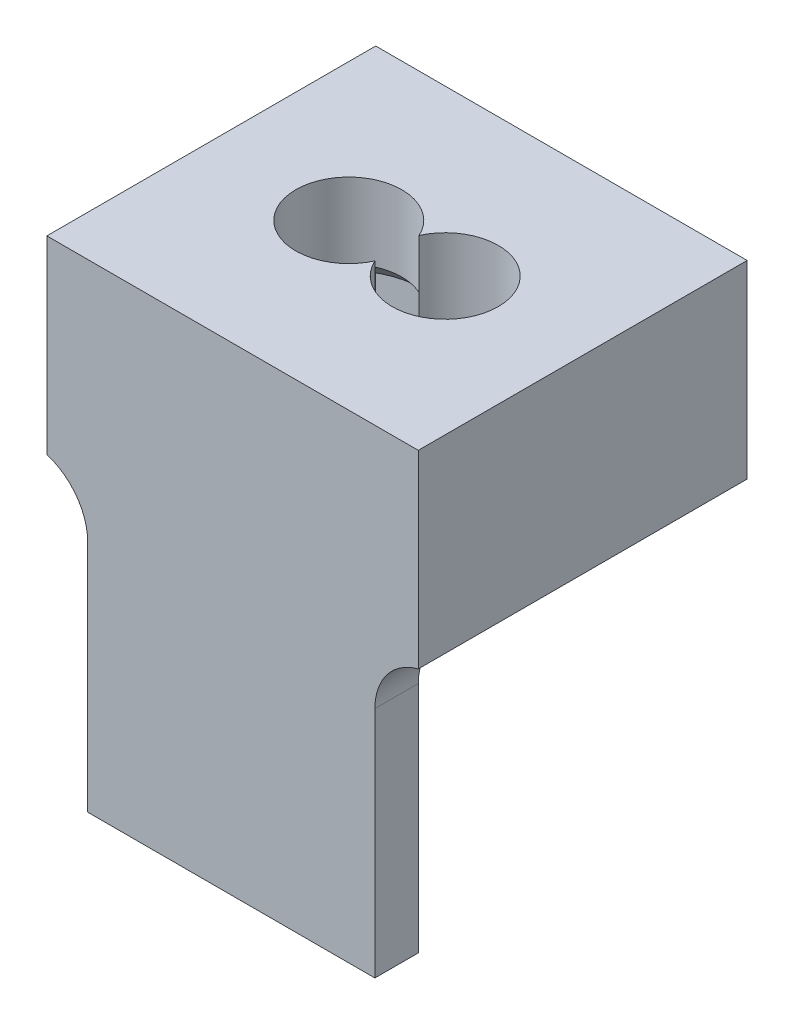
from build123d import *

# Parameters (mm, degrees)
BOSS_EXTRUDE1_DEPTH      = 0.7
BOSS_EXTRUDE1_DEPTH_BACK = 1.263
SKETCH1_W                = 3.850998
SKETCH1_H                = 3.4098
CAVITY1_START            = 0.637466597
CAVITY1_OUTLINE_W        = 2.67750798
CAVITY1_OUTLINE_H        = 0.979282
CAVITY1_DEPTH            = 2.231898
CAVITY1_2_DEPTH          = 0.410464
CAVITY1_START_2          = 2.458900597
CAVITY1_3_DEPTH          = 0.410464
CAVITY1_START_3          = -17.14430724
CAVITY1_4_DEPTH          = 2.648519043
CHAMFER1_SIZE            = 0.2
CHAMFER2_SIZE            = 0.15
SKETCH2_W                = 2.97750798
SKETCH2_H                = 0.45
BOSS_EXTRUDE2_DEPTH      = 3
FILLET1_R                = 0.6


with BuildPart() as part:
    # Sketch1 → Boss-Extrude1 (new, two sides: drawn at the far end of the back side and taken through both)
    with BuildSketch(Plane(origin=(0, 13.835346538, 0), x_dir=(1, 0, 0), z_dir=(0, 1, 0)).offset(-BOSS_EXTRUDE1_DEPTH_BACK)):
        with Locations((-15.821287197, -1.764464597)):
            Rectangle(SKETCH1_W, SKETCH1_H)
        with BuildLine():
            ThreePointArc((-15.821287197, -1.53533363), (-16.871286197, -1.764464597), (-15.821287197, -1.993595564))
            ThreePointArc((-15.821287197, -1.993595564), (-14.771288197, -1.764464597), (-15.821287197, -1.53533363))
        make_face(mode=Mode.SUBTRACT)
    extrude(amount=BOSS_EXTRUDE1_DEPTH + BOSS_EXTRUDE1_DEPTH_BACK)

    # Cavity1: read off the stored shape, not the designer's step
    # Cavity1 outline → Cavity1 (cut)
    with BuildSketch(Plane.XY.offset(CAVITY1_START)):
        with Locations((-15.834542187, 13.061987538)):
            Rectangle(CAVITY1_OUTLINE_W, CAVITY1_OUTLINE_H)
    extrude(amount=CAVITY1_DEPTH, mode=Mode.SUBTRACT)

    # Cavity1 2 outline → Cavity1 2 (cut)
    with BuildSketch(Plane.XY.offset(CAVITY1_START)):
        Polygon((-16.966571114, 13.859476538), (-17.14430724, 13.551628538), (-16.54477326, 13.551628538), (-16.726193134, 13.859476538), align=None)
        Polygon((-15.956573134, 13.859476538), (-16.13430926, 13.551628538), (-15.53477528, 13.551628538), (-15.716195154, 13.859476538), align=None)
        Polygon((-15.12431128, 13.551628538), (-14.495788197, 13.551628538), (-14.495788197, 13.859476538), (-14.946575154, 13.859476538), align=None)
    extrude(amount=CAVITY1_2_DEPTH, mode=Mode.SUBTRACT)

    # Cavity1 3 outline → Cavity1 3 (cut)
    with BuildSketch(Plane.XY.offset(CAVITY1_START_2)):
        Polygon((-16.966571114, 13.859476538), (-17.14430724, 13.551628538), (-16.54477326, 13.551628538), (-16.726193134, 13.859476538), align=None)
        Polygon((-15.956573134, 13.859476538), (-16.13430926, 13.551628538), (-15.53477528, 13.551628538), (-15.716195154, 13.859476538), align=None)
        Polygon((-15.12431128, 13.551628538), (-14.495788197, 13.551628538), (-14.495788197, 13.859476538), (-14.946575154, 13.859476538), align=None)
    extrude(amount=CAVITY1_3_DEPTH, mode=Mode.SUBTRACT)

    # Cavity1 4 outline → Cavity1 4 (add)
    with BuildSketch(Plane.YZ.offset(CAVITY1_START_3)):
        Polygon((13.859476538, 2.458900597), (13.859476538, 2.636636723), (13.551628538, 2.458900597), align=None)
        Polygon((13.859476538, 1.047930597), (13.551628538, 1.047930597), (13.859476538, 0.870194471), align=None)
    extrude(amount=CAVITY1_4_DEPTH)

    # Chamfer1
    # the kernel refuses this chamfer: 0.2 mm, written as the material it takes off along each edge
    with BuildSketch(Plane(origin=(-15.321288197, 13.551628538, 1.764464597), x_dir=(-0.9999950652018582, 0, -0.0031415874858801893), z_dir=(-0.0031415874858801893, 0, 0.9999950652018582))) as chamfer1_piece_1:
        Polygon((0.55, -CHAMFER1_SIZE), (0.55 + CHAMFER1_SIZE, 0), (0.55, 0), align=None)
    revolve(axis=Axis((-15.321288197, 13.551628538, 1.764464597), (0, -1, 0)), revolution_arc=359.64, mode=Mode.SUBTRACT)
    with BuildSketch(Plane(origin=(-16.321286197, 13.551628538, 1.764464597), x_dir=(0.9999950652018582, 0, 0.003141587485879382), z_dir=(0.003141587485879382, 0, -0.9999950652018582))) as chamfer1_piece_2:
        Polygon((0.55, -CHAMFER1_SIZE), (0.55 + CHAMFER1_SIZE, 0), (0.55, 0), align=None)
    revolve(axis=Axis((-16.321286197, 13.551628538, 1.764464597), (0, -1, 0)), revolution_arc=359.64, mode=Mode.SUBTRACT)

    # Chamfer2
    chamfer2_edges = [part.edges().sort_by_distance(p)[0] for p in [
        (-15.834542187, 12.572346538, 2.869364597),
        (-17.173296177, 12.572346538, 1.753415597),
        (-15.834542187, 12.572346538, 0.637466597),
        (-14.495788197, 12.572346538, 1.753415597),
    ]]
    chamfer(chamfer2_edges, length=CHAMFER2_SIZE)

    # Sketch2 → Boss-Extrude2 (add)
    with BuildSketch(Plane.XZ.offset(-12.572346538)):
        with Locations((-15.834542187, 3.244364597)):
            Rectangle(SKETCH2_W, SKETCH2_H)
    extrude(amount=BOSS_EXTRUDE2_DEPTH)

    # Fillet1
    # the kernel refuses this fillet: 0.6 mm, written as the material it adds along each edge
    with BuildSketch(Plane(origin=(-14.345788197, 12.572346538, 3.019364597), x_dir=(1, 0, 0), z_dir=(0, 0, 1))) as fillet1_piece_1:
        with BuildLine():
            CenterArc((0.6, -0.580947502), FILLET1_R, 104.477512186, 75.522487814)
            Line((0, -0.580947502), (0, 0))
            Line((0, 0), (0.45, 0))
        make_face()
    extrude(amount=0.45)
    with BuildSketch(Plane(origin=(-17.323296177, 12.572346538, 3.469364597), x_dir=(-1, 0, 0), z_dir=(0, 0, -1))) as fillet1_piece_2:
        with BuildLine():
            CenterArc((0.6, -0.573449411), FILLET1_R, 107.108570934, 72.891429066)
            Line((0, -0.573449411), (0, 0))
            Line((0, 0), (0.42349002, 0))
        make_face()
    extrude(amount=0.45)


solid = part.part
